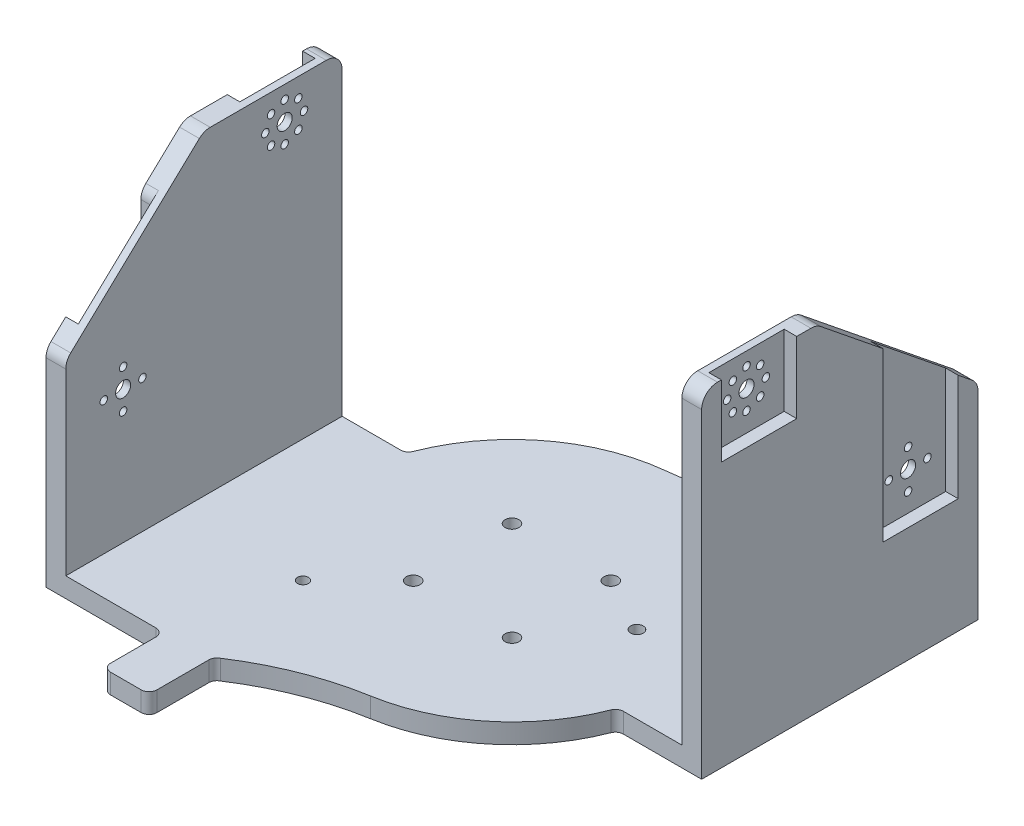
from build123d import *

# Parameters (mm, degrees)
SKETCH2_W                      = 230
SKETCH2_H                      = 283.251
BOSS_EXTRUDE1_DEPTH            = 10
SKETCH3_W                      = 10
SKETCH3_H                      = 283.251
BOSS_EXTRUDE2_DEPTH            = 170
M6_CLEARANCE_HOLE1_D           = 7
CUT_EXTRUDE1_DEPTH             = 327.431895271
CUT_EXTRUDE1_DEPTH_BACK        = 327.431895271
SKETCH7_R                      = 3.81
SKETCH7_R_2                    = 1.89865
SKETCH8_W                      = 6.35
SKETCH8_H                      = 38.1
CUT_EXTRUDE2_DEPTH             = 36.025
CUT_EXTRUDE3_DEPTH             = 6.35
CUT_EXTRUDE4_REACH             = 331.125
SKETCH11_R                     = 3.81
F_6_CLEARANCE_HOLE1_D          = 3.7973
F_6_CLEARANCE_HOLE1_DEPTH      = 3.65
CIRPATTERN1_COUNT              = 2
ENL_V_MAT_EXTRU_1_REACH        = 249.554
ESQUISSE1_R                    = 3.175
CBORE_FOR_M5_SHCS1_D           = 5.5
CBORE_FOR_M5_SHCS1_CBORE_D     = 10
CBORE_FOR_M5_SHCS1_CBORE_DEPTH = 5
CUT_EXTRUDE5_DEPTH             = 248.553594703
CUT_EXTRUDE5_DEPTH_BACK        = 248.553594703
SKETCH15_W                     = 58.825
SKETCH15_H                     = 30.860637148
CUT_EXTRUDE7_DEPTH             = 248.553594703
CUT_EXTRUDE7_DEPTH_BACK        = 248.553594703
SKETCH20_W                     = 0.765
SKETCH20_H                     = 30.860637148
FILLET2_R                      = 4
FILLET3_R                      = 144
FILLET4_R                      = 4
CUT_EXTRUDE8_REACH             = 335.853
CUT_EXTRUDE9_REACH             = 335.853
FILLET5_R                      = 8
FILLET6_R                      = 8


with BuildPart() as part:
    # Sketch2 → Boss-Extrude1 (new body)
    with BuildSketch(Plane(origin=(0, 0, 0), x_dir=(1, 0, 0), z_dir=(0, 1, 0))):
        Rectangle(SKETCH2_W, SKETCH2_H)
    extrude(amount=BOSS_EXTRUDE1_DEPTH)

    # Sketch3 → Boss-Extrude2 (add)
    with BuildSketch(Plane(origin=(0, 0, 0), x_dir=(1, 0, 0), z_dir=(0, 1, 0))):
        with Locations((-120, 0)):
            Rectangle(SKETCH3_W, SKETCH3_H)
        with Locations((120, 0)):
            Rectangle(SKETCH3_W, SKETCH3_H)
    extrude(amount=BOSS_EXTRUDE2_DEPTH)

    # M6 Clearance Hole1 (through all)
    with Locations(Plane(origin=(0, 10, 0), x_dir=(1, 0, 0), z_dir=(0, 1, 0))):
        with Locations((-25, 25), (25, 25), (25, -25), (-25, -25)):
            Hole(M6_CLEARANCE_HOLE1_D / 2)

    # Sketch7 → Cut-Extrude1 (cut, two sides: drawn at the far end of the back side and taken through both)
    with BuildSketch(Plane.ZY.offset(-115).offset(-CUT_EXTRUDE1_DEPTH_BACK)):
        with Locations((0, 153.49)):
            Circle(SKETCH7_R)
        with Locations((0, 163.269)):
            Circle(SKETCH7_R_2)
        with Locations((6.914797213, 160.404797213)):
            Circle(SKETCH7_R_2)
        with Locations((9.779, 153.49)):
            Circle(SKETCH7_R_2)
        with Locations((6.914797213, 146.575202787)):
            Circle(SKETCH7_R_2)
        with Locations((0, 143.711)):
            Circle(SKETCH7_R_2)
        with Locations((-6.914797213, 146.575202787)):
            Circle(SKETCH7_R_2)
        with Locations((-9.779, 153.49)):
            Circle(SKETCH7_R_2)
        with Locations((-6.914797213, 160.404797213)):
            Circle(SKETCH7_R_2)
    extrude(amount=CUT_EXTRUDE1_DEPTH + CUT_EXTRUDE1_DEPTH_BACK, mode=Mode.SUBTRACT)

    # Sketch8 → Cut-Extrude2 (cut)
    with BuildSketch(Plane(origin=(0, 170, 0), x_dir=(1, 0, 0), z_dir=(0, 1, 0))):
        with Locations((121.825, 0)):
            Rectangle(SKETCH8_W, SKETCH8_H)
        with Locations((-121.825, 0)):
            Rectangle(SKETCH8_W, SKETCH8_H)
    extrude(amount=-CUT_EXTRUDE2_DEPTH, mode=Mode.SUBTRACT)

    # Sketch9 → Cut-Extrude3 (cut)
    with BuildSketch(Plane(origin=(125, 0, 0), x_dir=(0, 0, -1), z_dir=(1, 0, 0))):
        Polygon((100.764862852, 96.554), (100.764862852, 58.026), (62.744862852, 58.026), (62.744862852, 96.554), (62.744862852, 170), (100.764862852, 170), align=None)
    cut_extrude3 = extrude(amount=-CUT_EXTRUDE3_DEPTH, mode=Mode.SUBTRACT)

    # Sketch11 → Cut-Extrude4 (cut, up to next)
    with BuildSketch(Plane(origin=(118.65, 0, 0), x_dir=(0, 0, -1), z_dir=(1, 0, 0)), mode=Mode.PRIVATE) as cut_extrude4_sk1:
        with Locations((81.754862852, 77.29)):
            Circle(SKETCH11_R)
    cut_extrude4_tool1 = extrude(cut_extrude4_sk1.sketch, amount=-CUT_EXTRUDE4_REACH, mode=Mode.PRIVATE) & part.part
    cut_extrude4 = cut_extrude4_tool1.solids().sort_by_distance((118.65, 77.29, -81.754863))[0]
    add(cut_extrude4, mode=Mode.SUBTRACT)

    # #6 Clearance Hole1
    with Locations(Plane(origin=(118.65, 0, 0), x_dir=(0, 0, -1), z_dir=(1, 0, 0))):
        with Locations((81.754862852, 87.069), (71.975862852, 77.29), (91.533862852, 77.29), (81.754862852, 67.511)):
            f_6_clearance_hole1 = Hole(F_6_CLEARANCE_HOLE1_D / 2, depth=F_6_CLEARANCE_HOLE1_DEPTH)

    # CirPattern1: Cut-Extrude3, Cut-Extrude4, #6 Clearance Hole1 ×2 about axis
    cirpattern1_axis = Axis((0, 0, 0), (0, 1, 0))
    add([cut_extrude3.rotate(cirpattern1_axis, i * 360 / CIRPATTERN1_COUNT) for i in range(1, CIRPATTERN1_COUNT)], mode=Mode.SUBTRACT)
    add([cut_extrude4.rotate(cirpattern1_axis, i * 360 / CIRPATTERN1_COUNT) for i in range(1, CIRPATTERN1_COUNT)], mode=Mode.SUBTRACT)
    add([f_6_clearance_hole1.rotate(cirpattern1_axis, i * 360 / CIRPATTERN1_COUNT) for i in range(1, CIRPATTERN1_COUNT)], mode=Mode.SUBTRACT)

    # Esquisse1 → Enlèv. mat.-Extru.1 (cut, up to next)
    with BuildSketch(Plane(origin=(0, 10, 0), x_dir=(1, 0, 0), z_dir=(0, 1, 0)), mode=Mode.PRIVATE) as enl_v_mat_extru_1_sk1:
        with Locations(Location((53, 110.739314032, 0), (0, 0, 270))):
            Circle(ESQUISSE1_R)
    enl_v_mat_extru_1_tool1 = extrude(enl_v_mat_extru_1_sk1.sketch, amount=-ENL_V_MAT_EXTRU_1_REACH, mode=Mode.PRIVATE) & part.part
    # Esquisse1 → Enlèv. mat.-Extru.1 (cut, up to next)
    with BuildSketch(Plane(origin=(0, 10, 0), x_dir=(1, 0, 0), z_dir=(0, 1, 0)), mode=Mode.PRIVATE) as enl_v_mat_extru_1_sk2:
        with Locations(Location((53, 10.203163452, 0), (0, 0, 270))):
            Circle(ESQUISSE1_R)
    enl_v_mat_extru_1_tool2 = extrude(enl_v_mat_extru_1_sk2.sketch, amount=-ENL_V_MAT_EXTRU_1_REACH, mode=Mode.PRIVATE) & part.part
    add(enl_v_mat_extru_1_tool1.solids().sort_by_distance((53, 10, -110.739314))[0], mode=Mode.SUBTRACT)
    add(enl_v_mat_extru_1_tool2.solids().sort_by_distance((53, 10, -10.203163))[0], mode=Mode.SUBTRACT)

    # CBORE for M5 SHCS1 (through all)
    with Locations(Plane(origin=(0, 0, 0), x_dir=(-1, 0, 0), z_dir=(0, -1, 0))):
        with Locations((53, -52.770411672), (53, -153.306562253)):
            CounterBoreHole(CBORE_FOR_M5_SHCS1_D / 2, CBORE_FOR_M5_SHCS1_CBORE_D / 2, CBORE_FOR_M5_SHCS1_CBORE_DEPTH)

    # Sketch15 → Cut-Extrude5 (cut, two sides: drawn at the far end of the back side and taken through both)
    with BuildSketch(Plane(origin=(0, 10, 0), x_dir=(1, 0, 0), z_dir=(0, 1, 0)).offset(-CUT_EXTRUDE5_DEPTH_BACK)):
        with BuildLine():
            Line((125, 141.6255), (-125, 141.6255))
            Line((-125, 141.6255), (-125, 29.05))
            Line((-125, 29.05), (-82.580571034, 29.05))
            ThreePointArc((-82.580571034, 29.05), (-32.48081845, 81.292371383), (39.825, 77.957825696))
            Line((39.825, 77.957825696), (39.825, 123.914314032))
            Line((39.825, 123.914314032), (66.175, 123.914314032))
            Line((66.175, 123.914314032), (66.175, 110.764862852))
            Line((66.175, 110.764862852), (125, 110.764862852))
            Line((125, 110.764862852), (125, 141.6255))
        make_face()
        with BuildLine():
            Line((125, -141.6255), (125, -29.05))
            Line((125, -29.05), (82.580571034, -29.05))
            ThreePointArc((82.580571034, -29.05), (32.48081845, -81.292371383), (-39.825, -77.957825696))
            Line((-39.825, -77.957825696), (-39.825, -141.6255))
            Line((-39.825, -141.6255), (125, -141.6255))
        make_face()
        with Locations((-95.5875, -126.195181426)):
            Rectangle(SKETCH15_W, SKETCH15_H)
    extrude(amount=CUT_EXTRUDE5_DEPTH + CUT_EXTRUDE5_DEPTH_BACK, mode=Mode.SUBTRACT)

    # Sketch20 → Cut-Extrude7 (cut, two sides: drawn at the far end of the back side and taken through both)
    with BuildSketch(Plane(origin=(0, 10, 0), x_dir=(1, 0, 0), z_dir=(0, 1, 0)).offset(-CUT_EXTRUDE7_DEPTH_BACK)):
        with Locations((-65.7925, -126.195181426)):
            Rectangle(SKETCH20_W, SKETCH20_H)
        with BuildLine():
            Line((-39.825, -141.6255), (-39.825, -107.748743461))
            ThreePointArc((-39.825, -107.748743461), (-41.410278355, -109.222344653), (-41.995854347, -111.306021378))
            Line((-41.995854347, -111.306021378), (-41.995854347, -141.6255))
            Line((-41.995854347, -141.6255), (-39.825, -141.6255))
        make_face()
        with BuildLine():
            Line((39.825, 123.914314032), (66.175, 123.914314032))
            Line((66.175, 123.914314032), (66.175, 110.764862852))
            Line((66.175, 110.764862852), (65.41, 110.764862852))
            Line((65.41, 110.764862852), (65.41, 116.58385488))
            ThreePointArc((65.41, 116.58385488), (64.238427125, 119.412282005), (61.41, 120.58385488))
            Line((61.41, 120.58385488), (46, 120.58385488))
            ThreePointArc((46, 120.58385488), (43.171572875, 119.412282005), (42, 116.58385488))
            Line((42, 116.58385488), (42, 104.58385488))
            ThreePointArc((42, 104.58385488), (41.413209633, 102.498189519), (39.825, 101.024448329))
            Line((39.825, 101.024448329), (39.825, 123.914314032))
        make_face()
    extrude(amount=CUT_EXTRUDE7_DEPTH + CUT_EXTRUDE7_DEPTH_BACK, mode=Mode.SUBTRACT)

    # Fillet2
    fillet2_edges = [part.edges().sort_by_distance(p)[0] for p in [
        (-65.41, 5, 141.6255),
        (-41.995854347, 5, 141.6255),
    ]]
    fillet(fillet2_edges, radius=FILLET2_R)

    # Fillet3
    # the kernel refuses this fillet: 144 mm, written as the material it adds along each edge
    with BuildSketch(Plane(origin=(39.825, 0, -77.957825696), x_dir=(-0.9828868635298122, 0, -0.18421024265911018), z_dir=(0, 1, 0))) as fillet3_piece_1:
        with BuildLine():
            CenterArc((90.33197894, -138.109046644), FILLET3_R, 106.445268475, 20.267064332)
            Line((4.249108153, -22.671880372), (2.527450737, -20.363137046))
            ThreePointArc((2.527450737, -20.363137046), (-0.706160091, -11.866465685), (-2.830714167, -0.530525499))
            Line((-2.830714167, -0.530525499), (0.815326005, 2.762180933))
            ThreePointArc((0.815326005, 2.762180933), (24.782839351, -0.701255836), (48.750352698, 2.762180933))
            Line((48.750352698, 2.762180933), (49.565678703, 0))
        make_face()
    extrude(amount=10)
    with BuildSketch(Plane(origin=(-39.825, 10, 77.957825696), x_dir=(0, 0, 1), z_dir=(0, -1, 0))) as fillet3_piece_2:
        with BuildLine():
            CenterArc((150.266135455, -78.877892483), FILLET3_R, 146.786309889, 23.503480659)
            Line((8.329161454, -54.590129896), (5.490421974, -54.104374645))
            ThreePointArc((5.490421974, -54.104374645), (5.734767963, -27.055491549), (-2.564719952, -1.310195239))
            Line((-2.564719952, -1.310195239), (0, 2.88))
            ThreePointArc((0, 2.88), (14.895458882, 2.88), (27.381413411, 1.57755785))
            Line((27.381413411, 1.57755785), (29.790917765, 0))
        make_face()
    extrude(amount=10)

    # Fillet4
    fillet4_edges = [part.edges().sort_by_distance(p)[0] for p in [
        (-82.580571034, 5, -29.05),
        (82.580571034, 5, 29.05),
        (-65.41, 5, 110.764862852),
        (65.41, 5, -110.764862852),
    ]]
    fillet(fillet4_edges, radius=FILLET4_R)

    # Sketch22 → Cut-Extrude8 (cut, up to next)
    with BuildSketch(Plane.ZY.offset(125), mode=Mode.PRIVATE) as cut_extrude8_sk1:
        Polygon((40.857431426, 170), (110.764862852, 104.051), (110.764862852, 170), align=None)
    cut_extrude8_tool1 = extrude(cut_extrude8_sk1.sketch, amount=-CUT_EXTRUDE8_REACH, mode=Mode.PRIVATE) & part.part
    add(cut_extrude8_tool1.solids().sort_by_distance((-125, 148.017, 87.462386))[0], mode=Mode.SUBTRACT)

    # Sketch23 → Cut-Extrude9 (cut, up to next)
    with BuildSketch(Plane(origin=(125, 0, 0), x_dir=(0, 0, -1), z_dir=(1, 0, 0)), mode=Mode.PRIVATE) as cut_extrude9_sk1:
        Polygon((29.05, 170), (110.764862852, 104.051), (110.764862852, 170), align=None)
    cut_extrude9_tool1 = extrude(cut_extrude9_sk1.sketch, amount=-CUT_EXTRUDE9_REACH, mode=Mode.PRIVATE) & part.part
    add(cut_extrude9_tool1.solids().sort_by_distance((125, 148.017, -83.526575))[0], mode=Mode.SUBTRACT)

    # Fillet5
    fillet5_edges = [part.edges().sort_by_distance(p)[0] for p in [
        (-120, 170, -29.05),
        (120, 170, 29.05),
        (-120, 170, 40.857431426),
        (-120, 104.051, 110.764862852),
        (120, 170, -29.05),
        (120, 104.051, -110.764862852),
    ]]
    fillet(fillet5_edges, radius=FILLET5_R)

    # Fillet6
    fillet6_edges = [part.edges().sort_by_distance(p)[0] for p in [
        (-121.825, 149.351920308, 62.744862852),
    ]]
    fillet(fillet6_edges, radius=FILLET6_R)


solid = part.part
